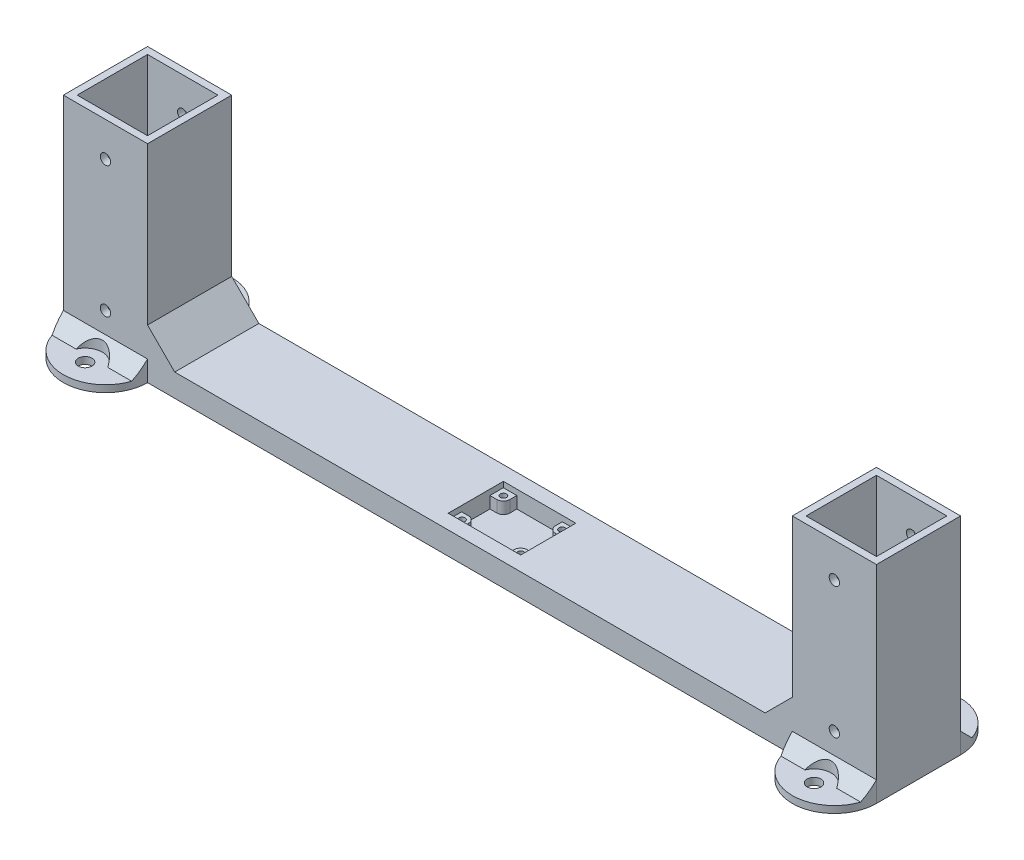
from build123d import *

# Parameters (mm, degrees)
SKETCH1_W               = 30.988
SKETCH1_H               = 30.988
SKETCH1_W_2             = 25.908
SKETCH1_H_2             = 25.908
BOSS_EXTRUDE1_DEPTH     = 76.2
BOSS_EXTRUDE1_2_DEPTH   = 76.2
SKETCH2_W               = 237.3884
SKETCH2_H               = 30.988
BOSS_EXTRUDE2_DEPTH     = 8.382
CHAMFER1_SIZE           = 10
SKETCH3_R               = 2.54
BOSS_EXTRUDE4_DEPTH     = 2.54
CHAMFER4_SIZE           = 5
SKETCH5_R               = 6.35
CUT_EXTRUDE2_DEPTH      = 170.678557104
SKETCH7_W               = 25.908
SKETCH7_H               = 25.908
BOSS_EXTRUDE5_DEPTH     = 2.54
CUT_EXTRUDE3_DEPTH      = 175.275004865
CUT_EXTRUDE3_DEPTH_BACK = 175.275004865
SKETCH8_R               = 1.905
SKETCH12_W              = 26.67
SKETCH12_H              = 20.32
CUT_EXTRUDE4_DEPTH      = 6.35
SKETCH14_R              = 1.143
BOSS_EXTRUDE7_DEPTH     = 4.318


with BuildPart() as part:
    # Sketch1 → Boss-Extrude1 (new body)
    with BuildSketch(Plane(origin=(0, 0, 0), x_dir=(1, 0, 0), z_dir=(0, 1, 0))):
        with Locations((134.1882, 0)):
            Rectangle(SKETCH1_W, SKETCH1_H)
        with Locations((134.1882, 0)):
            Rectangle(SKETCH1_W_2, SKETCH1_H_2, mode=Mode.SUBTRACT)
    extrude(amount=BOSS_EXTRUDE1_DEPTH)



with BuildPart() as body_2:
    # Sketch1 → Boss-Extrude1 2 (new body)
    with BuildSketch(Plane(origin=(0, 0, 0), x_dir=(1, 0, 0), z_dir=(0, 1, 0))):
        with Locations((-134.1882, 0)):
            Rectangle(SKETCH1_W, SKETCH1_H)
        with Locations((-134.1882, 0)):
            Rectangle(SKETCH1_W_2, SKETCH1_H_2, mode=Mode.SUBTRACT)
    extrude(amount=BOSS_EXTRUDE1_2_DEPTH)


with BuildPart() as part_1:
    add(part.part)

    add(body_2.part)  # Boss-Extrude2 merges body 2
    # Sketch2 → Boss-Extrude2 (add)
    with BuildSketch(Plane(origin=(0, 0, 0), x_dir=(1, 0, 0), z_dir=(0, 1, 0))):
        Rectangle(SKETCH2_W, SKETCH2_H)
    extrude(amount=BOSS_EXTRUDE2_DEPTH)

    # Chamfer1
    chamfer1_edges = [part_1.edges().sort_by_distance(p)[0] for p in [
        (-118.6942, 8.382, 0),
        (118.6942, 8.382, 0),
    ]]
    chamfer(chamfer1_edges, length=CHAMFER1_SIZE)

    # Sketch3 → Boss-Extrude4 (add)
    # profile 1 of 4: a face of its own
    with BuildSketch(Plane(origin=(0, 0, 0), x_dir=(1, 0, 0), z_dir=(0, 1, 0))):
        with BuildLine():
            Line((-149.6822, -15.494), (-118.6942, -15.494))
            ThreePointArc((-118.6942, -15.494), (-134.1882, -30.988), (-149.6822, -15.494))
        make_face()
        with Locations(Location((-134.1882, -22.988, 0), (0, 0, 270))):
            Circle(SKETCH3_R, mode=Mode.SUBTRACT)
    # profile 2 of 4: a face of its own
    with BuildSketch(Plane(origin=(0, 0, 0), x_dir=(1, 0, 0), z_dir=(0, 1, 0))):
        with BuildLine():
            ThreePointArc((-149.6822, 15.494), (-134.1882, 30.988), (-118.6942, 15.494))
            Line((-118.6942, 15.494), (-149.6822, 15.494))
        make_face()
        with Locations(Location((-134.1882, 22.988, 0), (0, 0, 270))):
            Circle(SKETCH3_R, mode=Mode.SUBTRACT)
    # profile 3 of 4: a face of its own
    with BuildSketch(Plane(origin=(0, 0, 0), x_dir=(1, 0, 0), z_dir=(0, 1, 0))):
        with BuildLine():
            Line((149.6822, 15.494), (118.6942, 15.494))
            ThreePointArc((118.6942, 15.494), (134.1882, 30.988), (149.6822, 15.494))
        make_face()
        with Locations(Location((134.1882, 22.988, 0), (0, 0, 270))):
            Circle(SKETCH3_R, mode=Mode.SUBTRACT)
    # profile 4 of 4: a face of its own
    with BuildSketch(Plane(origin=(0, 0, 0), x_dir=(1, 0, 0), z_dir=(0, 1, 0))):
        with BuildLine():
            ThreePointArc((149.6822, -15.494), (134.1882, -30.988), (118.6942, -15.494))
            Line((118.6942, -15.494), (149.6822, -15.494))
        make_face()
        with Locations(Location((134.1882, -22.988, 0), (0, 0, 270))):
            Circle(SKETCH3_R, mode=Mode.SUBTRACT)
    extrude(amount=BOSS_EXTRUDE4_DEPTH)

    # Chamfer4
    # the kernel refuses this chamfer: 5 mm, written as the material it adds along each edge
    with BuildSketch(Plane(origin=(-162.54061494, 2.54, 15.494), x_dir=(0, 0.9996219169112968, -0.027495876610586317), z_dir=(1, 0, 0))) as chamfer4_piece_1_section:
        Polygon((CHAMFER4_SIZE * 0.999621916911, CHAMFER4_SIZE * 0.0274958766106), (-CHAMFER4_SIZE * 0.0274958766106, CHAMFER4_SIZE * 0.999621916911), (0, 0), align=None)
    chamfer4_piece_1 = extrude(amount=56.70482988, mode=Mode.PRIVATE)
    chamfer4_piece_1 = chamfer4_piece_1 & Plane(origin=(-134.1882, 4.212595499, 15.494), x_dir=(1, 0, 0), z_dir=(0, -1, 0)) * Cylinder(15.494, 134, mode=Mode.PRIVATE)
    chamfer4_piece_1 = chamfer4_piece_1 - Plane(origin=(-134.1882, 4.212595499, 22.988), x_dir=(0, 0, 1), z_dir=(0, -1, 0)) * Cylinder(2.54, 134, mode=Mode.PRIVATE)
    add(chamfer4_piece_1)
    with BuildSketch(Plane(origin=(-105.83578506, 2.54, -15.494), x_dir=(0, 0.9996219169112968, 0.027495876610586317), z_dir=(-1, 0, 0))) as chamfer4_piece_2_section:
        Polygon((CHAMFER4_SIZE * 0.999621916911, CHAMFER4_SIZE * 0.0274958766106), (-CHAMFER4_SIZE * 0.0274958766106, CHAMFER4_SIZE * 0.999621916911), (0, 0), align=None)
    chamfer4_piece_2 = extrude(amount=56.70482988, mode=Mode.PRIVATE)
    chamfer4_piece_2 = chamfer4_piece_2 & Plane(origin=(-134.1882, 4.212595498, -15.494), x_dir=(-1, 0, 0), z_dir=(0, -1, 0)) * Cylinder(15.494, 134, mode=Mode.PRIVATE)
    chamfer4_piece_2 = chamfer4_piece_2 - Plane(origin=(-134.1882, 4.212595498, -22.988), x_dir=(0, 0, 1), z_dir=(0, -1, 0)) * Cylinder(2.54, 134, mode=Mode.PRIVATE)
    add(chamfer4_piece_2)
    with BuildSketch(Plane(origin=(162.54061494, 2.54, -15.494), x_dir=(0, 0.9996219169112968, 0.027495876610586317), z_dir=(-1, 0, 0))) as chamfer4_piece_3_section:
        Polygon((CHAMFER4_SIZE * 0.999621916911, CHAMFER4_SIZE * 0.0274958766106), (-CHAMFER4_SIZE * 0.0274958766106, CHAMFER4_SIZE * 0.999621916911), (0, 0), align=None)
    chamfer4_piece_3 = extrude(amount=56.70482988, mode=Mode.PRIVATE)
    chamfer4_piece_3 = chamfer4_piece_3 & Plane(origin=(134.1882, 4.212595498, -15.494), x_dir=(-1, 0, 0), z_dir=(0, -1, 0)) * Cylinder(15.494, 134, mode=Mode.PRIVATE)
    chamfer4_piece_3 = chamfer4_piece_3 - Plane(origin=(134.1882, 4.212595498, -22.988), x_dir=(0, 0, 1), z_dir=(0, -1, 0)) * Cylinder(2.54, 134, mode=Mode.PRIVATE)
    add(chamfer4_piece_3)
    with BuildSketch(Plane(origin=(105.83578506, 2.54, 15.494), x_dir=(0, 0.9996219169112968, -0.027495876610586317), z_dir=(1, 0, 0))) as chamfer4_piece_4_section:
        Polygon((CHAMFER4_SIZE * 0.999621916911, CHAMFER4_SIZE * 0.0274958766106), (-CHAMFER4_SIZE * 0.0274958766106, CHAMFER4_SIZE * 0.999621916911), (0, 0), align=None)
    chamfer4_piece_4 = extrude(amount=56.70482988, mode=Mode.PRIVATE)
    chamfer4_piece_4 = chamfer4_piece_4 & Plane(origin=(134.1882, 4.212595499, 15.494), x_dir=(1, 0, 0), z_dir=(0, -1, 0)) * Cylinder(15.494, 134, mode=Mode.PRIVATE)
    chamfer4_piece_4 = chamfer4_piece_4 - Plane(origin=(134.1882, 4.212595499, 22.988), x_dir=(0, 0, 1), z_dir=(0, -1, 0)) * Cylinder(2.54, 134, mode=Mode.PRIVATE)
    add(chamfer4_piece_4)

    # Sketch5 → Cut-Extrude2 (cut, through all)
    with BuildSketch(Plane(origin=(0, 2.54, 0), x_dir=(1, 0, 0), z_dir=(0, 1, 0))):
        with Locations((-134.1882, 22.988)):
            Circle(SKETCH5_R)
        with Locations((134.1882, 22.988)):
            Circle(SKETCH5_R)
        with Locations((134.1882, -22.988)):
            Circle(SKETCH5_R)
        with Locations((-134.1882, -22.988)):
            Circle(SKETCH5_R)
    extrude(amount=CUT_EXTRUDE2_DEPTH, mode=Mode.SUBTRACT)

    # Sketch7 → Boss-Extrude5 (add)
    with BuildSketch(Plane(origin=(0, 0, 0), x_dir=(1, 0, 0), z_dir=(0, 1, 0))):
        with Locations((-134.1882, 0)):
            Rectangle(SKETCH7_W, SKETCH7_H)
        with Locations((134.1882, 0)):
            Rectangle(SKETCH7_W, SKETCH7_H)
    extrude(amount=BOSS_EXTRUDE5_DEPTH)

    # Sketch8 → Cut-Extrude3 (cut, two sides: drawn at the far end of the back side and taken through both)
    with BuildSketch(Plane.XY.offset(15.494).offset(-CUT_EXTRUDE3_DEPTH_BACK)):
        with Locations((-134.1882, 15.24)):
            Circle(SKETCH8_R)
        with Locations((134.1882, 15.24)):
            Circle(SKETCH8_R)
        with Locations((-134.1882, 63.5)):
            Circle(SKETCH8_R)
        with Locations((134.1882, 63.5)):
            Circle(SKETCH8_R)
    extrude(amount=CUT_EXTRUDE3_DEPTH + CUT_EXTRUDE3_DEPTH_BACK, mode=Mode.SUBTRACT)

    # Sketch12 → Cut-Extrude4 (cut)
    with BuildSketch(Plane(origin=(0, 8.382, 0), x_dir=(1, 0, 0), z_dir=(0, 1, 0))):
        Rectangle(SKETCH12_W, SKETCH12_H)
    extrude(amount=-CUT_EXTRUDE4_DEPTH, mode=Mode.SUBTRACT)

    # Sketch14 → Boss-Extrude7 (add)
    # profile 1 of 4: a face of its own
    with BuildSketch(Plane(origin=(0, 2.032, 0), x_dir=(1, 0, 0), z_dir=(0, 1, 0))):
        with BuildLine():
            Line((-8.382, -7.62), (-8.382, -10.16))
            Line((-8.382, -10.16), (-13.335, -10.16))
            Line((-13.335, -10.16), (-13.335, -5.207))
            Line((-13.335, -5.207), (-10.795, -5.207))
            ThreePointArc((-10.795, -5.207), (-9.088751337, -5.913751337), (-8.382, -7.62))
        make_face()
        with Locations(Location((-10.795, -7.62, 0), (0, 0, 270))):
            Circle(SKETCH14_R, mode=Mode.SUBTRACT)
    # profile 2 of 4: a face of its own
    with BuildSketch(Plane(origin=(0, 2.032, 0), x_dir=(1, 0, 0), z_dir=(0, 1, 0))):
        with BuildLine():
            Line((8.382, -7.62), (8.382, -10.16))
            Line((8.382, -10.16), (13.335, -10.16))
            Line((13.335, -10.16), (13.335, -5.207))
            Line((13.335, -5.207), (10.795, -5.207))
            ThreePointArc((10.795, -5.207), (9.088751337, -5.913751337), (8.382, -7.62))
        make_face()
        with Locations(Location((10.795, -7.62, 0), (0, 0, 90))):
            Circle(SKETCH14_R, mode=Mode.SUBTRACT)
    # profile 3 of 4: a face of its own
    with BuildSketch(Plane(origin=(0, 2.032, 0), x_dir=(1, 0, 0), z_dir=(0, 1, 0))):
        with BuildLine():
            Line((8.382, 7.62), (8.382, 10.16))
            Line((8.382, 10.16), (13.335, 10.16))
            Line((13.335, 10.16), (13.335, 5.207))
            Line((13.335, 5.207), (10.795, 5.207))
            ThreePointArc((10.795, 5.207), (9.088751337, 5.913751337), (8.382, 7.62))
        make_face()
        with Locations(Location((10.795, 7.62, 0), (0, 0, 270))):
            Circle(SKETCH14_R, mode=Mode.SUBTRACT)
    # profile 4 of 4: a face of its own
    with BuildSketch(Plane(origin=(0, 2.032, 0), x_dir=(1, 0, 0), z_dir=(0, 1, 0))):
        with BuildLine():
            Line((-8.382, 7.62), (-8.382, 10.16))
            Line((-8.382, 10.16), (-13.335, 10.16))
            Line((-13.335, 10.16), (-13.335, 5.207))
            Line((-13.335, 5.207), (-10.795, 5.207))
            ThreePointArc((-10.795, 5.207), (-9.088751337, 5.913751337), (-8.382, 7.62))
        make_face()
        with Locations(Location((-10.795, 7.62, 0), (0, 0, 90))):
            Circle(SKETCH14_R, mode=Mode.SUBTRACT)
    extrude(amount=BOSS_EXTRUDE7_DEPTH)


solid = part_1.part
